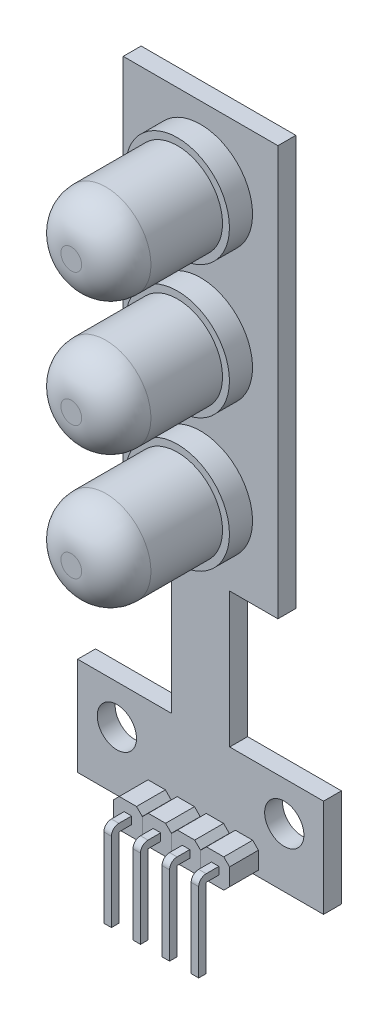
from build123d import *

# Parameters (mm, degrees)
SKETCH1_R               = 1.7
BOSS_EXTRUDE1_DEPTH     = 1.55
SKETCH2_R               = 4.5
BOSS_EXTRUDE2_DEPTH     = 2
SKETCH3_R               = 3.9
BOSS_EXTRUDE3_DEPTH     = 9.2
FILLET1_R               = 3
SKETCH4_W               = 2.5
SKETCH4_H               = 2.5
BOSS_EXTRUDE5_DEPTH     = 2.5
CHAMFER1_SIZE           = 0.5
SKETCH5_W               = 0.25
SKETCH5_H               = 1.5
BOSS_EXTRUDE6_DEPTH     = 2
BOSS_EXTRUDE7_START     = -3.8
BOSS_EXTRUDE7_DEPTH     = 0.325
LPATTERN1_START         = 1.55
LPATTERN1_DEPTH         = 2.5
LPATTERN1_START_2       = 5.15
LPATTERN1_2_OUTLINE_W   = 0.65
LPATTERN1_2_OUTLINE_H   = 6.85
LPATTERN1_2_DEPTH       = 0.65
LPATTERN1_START_3       = 4.05
LPATTERN1_3_OUTLINE_W   = 0.65
LPATTERN1_3_OUTLINE_H   = 0.65
LPATTERN1_3_DEPTH       = 1.1
LPATTERN1_4_OUTLINE_W   = 0.02
LPATTERN1_4_OUTLINE_H   = 1.5
LPATTERN1_4_OUTLINE_W_2 = 0.25
LPATTERN1_4_DEPTH       = 2
LPATTERN1_START_4       = -1.605
LPATTERN1_5_DEPTH       = 0.65
LPATTERN1_START_5       = 0.915
LPATTERN1_6_DEPTH       = 0.65
LPATTERN1_START_6       = 3.435
LPATTERN1_7_DEPTH       = 0.65
DELETEFACE1_START       = 5.01
DELETEFACE1_OUTLINE_W   = 1.5
DELETEFACE1_OUTLINE_H   = 2
DELETEFACE1_DEPTH       = 0.25


with BuildPart() as part:
    # Sketch1 → Boss-Extrude1 (new body)
    with BuildSketch(Plane.XY):
        Polygon((-6.7, 17.75), (6.7, 17.75), (6.7, -17.75), (2.525, -17.75), (2.525, -29.45), (10.65, -29.45), (10.65, -37.95), (-10.65, -37.95), (-10.65, -29.45), (-2.525, -29.45), (-2.525, -17.75), (-6.7, -17.75), align=None)
        with Locations(Location((-7.25, -32.85, 0), (0, 0, 180))):
            Circle(SKETCH1_R, mode=Mode.SUBTRACT)
        with Locations(Location((7.25, -32.85, 0), (0, 0, 180))):
            Circle(SKETCH1_R, mode=Mode.SUBTRACT)
    extrude(amount=BOSS_EXTRUDE1_DEPTH)

    # Sketch2 → Boss-Extrude2 (add)
    with BuildSketch(Plane.XY.offset(1.55)):
        with Locations(Location((0, 11.5, 0), (0, 0, 180))):
            Circle(SKETCH2_R)
        with Locations(Location((0, 0, 0), (0, 0, 180))):
            Circle(SKETCH2_R)
        with Locations(Location((0, -11.5, 0), (0, 0, 180))):
            Circle(SKETCH2_R)
    extrude(amount=BOSS_EXTRUDE2_DEPTH)

    # Sketch3 → Boss-Extrude3 (add)
    with BuildSketch(Plane.XY.offset(3.55)):
        Circle(SKETCH3_R)
        with Locations((0, 11.5)):
            Circle(SKETCH3_R)
        with Locations((0, -11.5)):
            Circle(SKETCH3_R)
    extrude(amount=BOSS_EXTRUDE3_DEPTH)

    # Fillet1
    fillet1_edges = [part.edges().sort_by_distance(p)[0] for p in [
        (-3.9, 0, 12.75),
        (-3.9, 11.5, 12.75),
        (-3.9, -11.5, 12.75),
    ]]
    fillet(fillet1_edges, radius=FILLET1_R)

    # Sketch4 → Boss-Extrude5 (add)
    with BuildSketch(Plane.XY.offset(1.55)):
        with Locations((-3.8, -36.7)):
            Rectangle(SKETCH4_W, SKETCH4_H)
    extrude(amount=BOSS_EXTRUDE5_DEPTH)

    # Chamfer1
    chamfer1_edges = [part.edges().sort_by_distance(p)[0] for p in [
        (-2.55, -37.95, 2.8),
        (-2.55, -35.45, 2.8),
        (-5.05, -35.45, 2.8),
        (-5.05, -37.95, 2.8),
    ]]
    chamfer(chamfer1_edges, length=CHAMFER1_SIZE)

    # Sketch5 → Boss-Extrude6 (add)
    with BuildSketch(Plane.XY.offset(1.55)):
        with Locations((-2.425, -36.7)):
            Rectangle(SKETCH5_W, SKETCH5_H)
    extrude(amount=BOSS_EXTRUDE6_DEPTH)

    # Sketch6 → Boss-Extrude7 (add, symmetric)
    with BuildSketch(Plane(origin=(0, 0, 0), x_dir=(0, 0, -1), z_dir=(1, 0, 0)).offset(BOSS_EXTRUDE7_START)):
        with BuildLine():
            Line((-4.05, -36.375), (-5.15, -36.375))
            ThreePointArc((-5.15, -36.375), (-5.609619408, -36.565380592), (-5.8, -37.025))
            Line((-5.8, -37.025), (-5.8, -43.875))
            Line((-5.8, -43.875), (-5.15, -43.875))
            Line((-5.15, -43.875), (-5.15, -37.025))
            Line((-5.15, -37.025), (-4.05, -37.025))
            Line((-4.05, -37.025), (-4.05, -36.375))
        make_face()
    extrude(amount=BOSS_EXTRUDE7_DEPTH, both=True)

    # LPattern1: read off the stored shape, not the designer's step
    # LPattern1 outline → LPattern1 (add)
    with BuildSketch(Plane.XY.offset(LPATTERN1_START)):
        Polygon((-0.01, -35.95), (-0.01, -37.45), (0.49, -37.95), (1.99, -37.95), (2.49, -37.45), (2.49, -35.95), (1.99, -35.45), (0.49, -35.45), align=None)
        Polygon((-0.53, -37.95), (-0.03, -37.45), (-0.03, -35.95), (-0.53, -35.45), (-2.03, -35.45), (-2.53, -35.95), (-2.53, -37.45), (-2.03, -37.95), align=None)
        Polygon((3.01, -35.45), (2.51, -35.95), (2.51, -37.45), (3.01, -37.95), (4.51, -37.95), (5.01, -37.45), (5.01, -35.95), (4.51, -35.45), align=None)
    extrude(amount=LPATTERN1_DEPTH)



with BuildPart() as body_2:
    # LPattern1 2 outline → LPattern1 2 (new body)
    with BuildSketch(Plane.XY.offset(LPATTERN1_START_2)):
        with Locations((1.24, -40.45)):
            Rectangle(LPATTERN1_2_OUTLINE_W, LPATTERN1_2_OUTLINE_H)
        with Locations((-1.28, -40.45)):
            Rectangle(LPATTERN1_2_OUTLINE_W, LPATTERN1_2_OUTLINE_H)
        with Locations((3.76, -40.45)):
            Rectangle(LPATTERN1_2_OUTLINE_W, LPATTERN1_2_OUTLINE_H)
    extrude(amount=LPATTERN1_2_DEPTH)


with BuildPart() as part_1:
    add(part.part)

    add(body_2.part)  # LPattern1 3 merges body 2
    # LPattern1 3 outline → LPattern1 3 (add)
    with BuildSketch(Plane.XY.offset(LPATTERN1_START_3)):
        with Locations((1.24, -36.7)):
            Rectangle(LPATTERN1_3_OUTLINE_W, LPATTERN1_3_OUTLINE_H)
        with Locations((-1.28, -36.7)):
            Rectangle(LPATTERN1_3_OUTLINE_W, LPATTERN1_3_OUTLINE_H)
        with Locations((3.76, -36.7)):
            Rectangle(LPATTERN1_3_OUTLINE_W, LPATTERN1_3_OUTLINE_H)
    extrude(amount=LPATTERN1_3_DEPTH)

    # LPattern1 4 outline → LPattern1 4 (add)
    with BuildSketch(Plane.XY.offset(LPATTERN1_START)):
        with Locations((-0.02, -36.7)):
            Rectangle(LPATTERN1_4_OUTLINE_W, LPATTERN1_4_OUTLINE_H)
        with Locations((2.5, -36.7)):
            Rectangle(LPATTERN1_4_OUTLINE_W, LPATTERN1_4_OUTLINE_H)
        with Locations((5.135, -36.7)):
            Rectangle(LPATTERN1_4_OUTLINE_W_2, LPATTERN1_4_OUTLINE_H)
    extrude(amount=LPATTERN1_4_DEPTH)

    # LPattern1 5 outline → LPattern1 5 (add)
    with BuildSketch(Plane.YZ.offset(LPATTERN1_START_4)):
        with BuildLine():
            ThreePointArc((-36.375, 5.15), (-36.565380592, 5.609619408), (-37.025, 5.8))
            Line((-37.025, 5.8), (-37.025, 5.15))
            Line((-37.025, 5.15), (-36.375, 5.15))
        make_face()
    extrude(amount=LPATTERN1_5_DEPTH)

    # LPattern1 6 outline → LPattern1 6 (add)
    with BuildSketch(Plane.YZ.offset(LPATTERN1_START_5)):
        with BuildLine():
            ThreePointArc((-36.375, 5.15), (-36.565380592, 5.609619408), (-37.025, 5.8))
            Line((-37.025, 5.8), (-37.025, 5.15))
            Line((-37.025, 5.15), (-36.375, 5.15))
        make_face()
    extrude(amount=LPATTERN1_6_DEPTH)

    # LPattern1 7 outline → LPattern1 7 (add)
    with BuildSketch(Plane.YZ.offset(LPATTERN1_START_6)):
        with BuildLine():
            ThreePointArc((-36.375, 5.15), (-36.565380592, 5.609619408), (-37.025, 5.8))
            Line((-37.025, 5.8), (-37.025, 5.15))
            Line((-37.025, 5.15), (-36.375, 5.15))
        make_face()
    extrude(amount=LPATTERN1_7_DEPTH)

    # DeleteFace1: read off the stored shape, not the designer's step
    # DeleteFace1 outline → DeleteFace1 (cut)
    with BuildSketch(Plane.YZ.offset(DELETEFACE1_START)):
        with Locations((-36.7, 2.55)):
            Rectangle(DELETEFACE1_OUTLINE_W, DELETEFACE1_OUTLINE_H)
    extrude(amount=DELETEFACE1_DEPTH, mode=Mode.SUBTRACT)


solid = part_1.part
